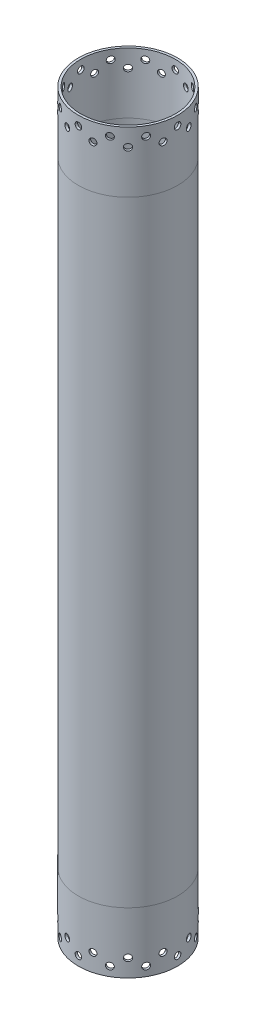
from build123d import *

# Parameters (mm, degrees)
SKETCH2_R                = 76.2
SKETCH2_R_2              = 72.5932
BOSS_EXTRUDE1_DEPTH      = 1130.3
SKETCH3_R                = 5.0419
CUT_EXTRUDE1_DEPTH       = 1143
SKETCH6_R                = 5.0419
CUT_EXTRUDE2_DEPTH       = 25.4
CIRPATTERN2_COUNT        = 12
MIRROR1_COPY_1_SKETCH_R  = 5.0419
MIRROR1_COPY_1_DEPTH     = 1143
MIRROR1_COPY_2_SKETCH_R  = 5.0419
MIRROR1_COPY_2_DEPTH     = 1143
MIRROR1_COPY_3_SKETCH_R  = 5.0419
MIRROR1_COPY_3_DEPTH     = 1143
MIRROR1_COPY_4_SKETCH_R  = 5.0419
MIRROR1_COPY_4_DEPTH     = 1143
MIRROR1_COPY_5_SKETCH_R  = 5.0419
MIRROR1_COPY_5_DEPTH     = 1143
MIRROR1_COPY_6_SKETCH_R  = 5.0419
MIRROR1_COPY_6_DEPTH     = 1143
MIRROR1_COPY_7_SKETCH_R  = 5.0419
MIRROR1_COPY_7_DEPTH     = 1143
MIRROR1_COPY_8_SKETCH_R  = 5.0419
MIRROR1_COPY_8_DEPTH     = 1143
MIRROR1_COPY_9_SKETCH_R  = 5.0419
MIRROR1_COPY_9_DEPTH     = 1143
MIRROR1_COPY_10_SKETCH_R = 5.0419
MIRROR1_COPY_10_DEPTH    = 1143
MIRROR1_COPY_11_SKETCH_R = 5.0419
MIRROR1_COPY_11_DEPTH    = 1143
MIRROR1_COPY_12_SKETCH_R = 5.0419
MIRROR1_COPY_12_DEPTH    = 25.4
MIRROR1_COPY_13_SKETCH_R = 5.0419
MIRROR1_COPY_13_DEPTH    = 25.4
MIRROR1_COPY_14_SKETCH_R = 5.0419
MIRROR1_COPY_14_DEPTH    = 25.4
MIRROR1_COPY_15_SKETCH_R = 5.0419
MIRROR1_COPY_15_DEPTH    = 25.4
MIRROR1_COPY_16_SKETCH_R = 5.0419
MIRROR1_COPY_16_DEPTH    = 25.4
MIRROR1_COPY_17_SKETCH_R = 5.0419
MIRROR1_COPY_17_DEPTH    = 25.4
MIRROR1_COPY_18_SKETCH_R = 5.0419
MIRROR1_COPY_18_DEPTH    = 25.4
MIRROR1_COPY_19_SKETCH_R = 5.0419
MIRROR1_COPY_19_DEPTH    = 25.4
MIRROR1_COPY_20_SKETCH_R = 5.0419
MIRROR1_COPY_20_DEPTH    = 25.4
MIRROR1_COPY_21_SKETCH_R = 5.0419
MIRROR1_COPY_21_DEPTH    = 25.4
MIRROR1_COPY_22_SKETCH_R = 5.0419
MIRROR1_COPY_22_DEPTH    = 25.4
MIRROR1_COPY_23_SKETCH_R = 5.0419
MIRROR1_COPY_23_DEPTH    = 1143
MIRROR1_COPY_24_SKETCH_R = 5.0419
MIRROR1_COPY_24_DEPTH    = 25.4


with BuildPart() as part:
    # Sketch2 → Boss-Extrude1 (new body)
    with BuildSketch(Plane(origin=(0, 0, 0), x_dir=(1, 0, 0), z_dir=(0, 1, 0))):
        Circle(SKETCH2_R)
        Circle(SKETCH2_R_2, mode=Mode.SUBTRACT)
    extrude(amount=BOSS_EXTRUDE1_DEPTH)

    # Sketch3 → Cut-Extrude1 (cut)
    with BuildSketch(Plane.XY):
        with Locations((0, 1116.203)):
            Circle(SKETCH3_R)
    cut_extrude1 = extrude(amount=-CUT_EXTRUDE1_DEPTH, mode=Mode.SUBTRACT)

    # Sketch6 → Cut-Extrude2 (cut)
    with BuildSketch(Plane(origin=(-19.722011237, 0, 73.603547963), x_dir=(0, -1, 0), z_dir=(-0.25881904510252135, 0, 0.9659258262890681))):
        with Locations((-1103.503, 0)):
            Circle(SKETCH6_R)
    cut_extrude2 = extrude(amount=-CUT_EXTRUDE2_DEPTH, mode=Mode.SUBTRACT)

    # CirPattern2: Cut-Extrude1, Cut-Extrude2 ×12 about axis
    cirpattern2_axis = Axis((0, 1130.3, 0), (0, -1, 0))
    add([cut_extrude1.rotate(cirpattern2_axis, i * 360 / CIRPATTERN2_COUNT) for i in range(1, CIRPATTERN2_COUNT)], mode=Mode.SUBTRACT)
    add([cut_extrude2.rotate(cirpattern2_axis, i * 360 / CIRPATTERN2_COUNT) for i in range(1, CIRPATTERN2_COUNT)], mode=Mode.SUBTRACT)

    # Mirror1 copy 1 sketch → Mirror1 copy 1 (cut)
    with BuildSketch(Plane(origin=(0, 1130.3, 0), x_dir=(0.8660254037844387, 0, 0.49999999999999994), z_dir=(-0.49999999999999994, 0, 0.8660254037844387))):
        with Locations((0, -1116.203)):
            Circle(MIRROR1_COPY_1_SKETCH_R)
    extrude(amount=-MIRROR1_COPY_1_DEPTH, mode=Mode.SUBTRACT)

    # Mirror1 copy 2 sketch → Mirror1 copy 2 (cut)
    with BuildSketch(Plane(origin=(0, 1130.3, 0), x_dir=(0.5000000000000001, 0, 0.8660254037844386), z_dir=(-0.8660254037844386, 0, 0.5000000000000001))):
        with Locations((0, -1116.203)):
            Circle(MIRROR1_COPY_2_SKETCH_R)
    extrude(amount=-MIRROR1_COPY_2_DEPTH, mode=Mode.SUBTRACT)

    # Mirror1 copy 3 sketch → Mirror1 copy 3 (cut)
    with BuildSketch(Plane(origin=(0, 1130.3, 0), x_dir=(0, 0, 1), z_dir=(-1, 0, 0))):
        with Locations((0, -1116.203)):
            Circle(MIRROR1_COPY_3_SKETCH_R)
    extrude(amount=-MIRROR1_COPY_3_DEPTH, mode=Mode.SUBTRACT)

    # Mirror1 copy 4 sketch → Mirror1 copy 4 (cut)
    with BuildSketch(Plane(origin=(0, 1130.3, 0), x_dir=(-0.4999999999999998, 0, 0.8660254037844387), z_dir=(-0.8660254037844387, 0, -0.4999999999999998))):
        with Locations((0, -1116.203)):
            Circle(MIRROR1_COPY_4_SKETCH_R)
    extrude(amount=-MIRROR1_COPY_4_DEPTH, mode=Mode.SUBTRACT)

    # Mirror1 copy 5 sketch → Mirror1 copy 5 (cut)
    with BuildSketch(Plane(origin=(0, 1130.3, 0), x_dir=(-0.8660254037844387, 0, 0.49999999999999994), z_dir=(-0.49999999999999994, 0, -0.8660254037844387))):
        with Locations((0, -1116.203)):
            Circle(MIRROR1_COPY_5_SKETCH_R)
    extrude(amount=-MIRROR1_COPY_5_DEPTH, mode=Mode.SUBTRACT)

    # Mirror1 copy 6 sketch → Mirror1 copy 6 (cut)
    with BuildSketch(Plane(origin=(0, 1130.3, 0), x_dir=(-1, 0, 0), z_dir=(0, 0, -1))):
        with Locations((0, -1116.203)):
            Circle(MIRROR1_COPY_6_SKETCH_R)
    extrude(amount=-MIRROR1_COPY_6_DEPTH, mode=Mode.SUBTRACT)

    # Mirror1 copy 7 sketch → Mirror1 copy 7 (cut)
    with BuildSketch(Plane(origin=(0, 1130.3, 0), x_dir=(-0.8660254037844386, 0, -0.5000000000000001), z_dir=(0.5000000000000001, 0, -0.8660254037844386))):
        with Locations((0, -1116.203)):
            Circle(MIRROR1_COPY_7_SKETCH_R)
    extrude(amount=-MIRROR1_COPY_7_DEPTH, mode=Mode.SUBTRACT)

    # Mirror1 copy 8 sketch → Mirror1 copy 8 (cut)
    with BuildSketch(Plane(origin=(0, 1130.3, 0), x_dir=(-0.5000000000000004, 0, -0.8660254037844384), z_dir=(0.8660254037844384, 0, -0.5000000000000004))):
        with Locations((0, -1116.203)):
            Circle(MIRROR1_COPY_8_SKETCH_R)
    extrude(amount=-MIRROR1_COPY_8_DEPTH, mode=Mode.SUBTRACT)

    # Mirror1 copy 9 sketch → Mirror1 copy 9 (cut)
    with BuildSketch(Plane(origin=(0, 1130.3, 0), x_dir=(0, 0, -1), z_dir=(1, 0, 0))):
        with Locations((0, -1116.203)):
            Circle(MIRROR1_COPY_9_SKETCH_R)
    extrude(amount=-MIRROR1_COPY_9_DEPTH, mode=Mode.SUBTRACT)

    # Mirror1 copy 10 sketch → Mirror1 copy 10 (cut)
    with BuildSketch(Plane(origin=(0, 1130.3, 0), x_dir=(0.5000000000000001, 0, -0.8660254037844386), z_dir=(0.8660254037844386, 0, 0.5000000000000001))):
        with Locations((0, -1116.203)):
            Circle(MIRROR1_COPY_10_SKETCH_R)
    extrude(amount=-MIRROR1_COPY_10_DEPTH, mode=Mode.SUBTRACT)

    # Mirror1 copy 11 sketch → Mirror1 copy 11 (cut)
    with BuildSketch(Plane(origin=(0, 1130.3, 0), x_dir=(0.8660254037844384, 0, -0.5000000000000004), z_dir=(0.5000000000000004, 0, 0.8660254037844384))):
        with Locations((0, -1116.203)):
            Circle(MIRROR1_COPY_11_SKETCH_R)
    extrude(amount=-MIRROR1_COPY_11_DEPTH, mode=Mode.SUBTRACT)

    # Mirror1 copy 12 sketch → Mirror1 copy 12 (cut)
    with BuildSketch(Plane(origin=(-53.881536726, 1130.3, 53.881536726), x_dir=(0, 1, 0), z_dir=(-0.7071067811865479, 0, 0.7071067811865472))):
        with Locations((-1103.503, 0)):
            Circle(MIRROR1_COPY_12_SKETCH_R)
    extrude(amount=-MIRROR1_COPY_12_DEPTH, mode=Mode.SUBTRACT)

    # Mirror1 copy 13 sketch → Mirror1 copy 13 (cut)
    with BuildSketch(Plane(origin=(-73.603547963, 1130.3, 19.722011237), x_dir=(0, 1, 0), z_dir=(-0.9659258262890684, 0, 0.2588190451025203))):
        with Locations((-1103.503, 0)):
            Circle(MIRROR1_COPY_13_SKETCH_R)
    extrude(amount=-MIRROR1_COPY_13_DEPTH, mode=Mode.SUBTRACT)

    # Mirror1 copy 14 sketch → Mirror1 copy 14 (cut)
    with BuildSketch(Plane(origin=(-73.603547963, 1130.3, -19.722011237), x_dir=(0, 1, 0), z_dir=(-0.9659258262890681, 0, -0.2588190451025213))):
        with Locations((-1103.503, 0)):
            Circle(MIRROR1_COPY_14_SKETCH_R)
    extrude(amount=-MIRROR1_COPY_14_DEPTH, mode=Mode.SUBTRACT)

    # Mirror1 copy 15 sketch → Mirror1 copy 15 (cut)
    with BuildSketch(Plane(origin=(-53.881536726, 1130.3, -53.881536726), x_dir=(0, 1, 0), z_dir=(-0.7071067811865472, 0, -0.7071067811865477))):
        with Locations((-1103.503, 0)):
            Circle(MIRROR1_COPY_15_SKETCH_R)
    extrude(amount=-MIRROR1_COPY_15_DEPTH, mode=Mode.SUBTRACT)

    # Mirror1 copy 16 sketch → Mirror1 copy 16 (cut)
    with BuildSketch(Plane(origin=(-19.722011237, 1130.3, -73.603547963), x_dir=(0, 1, 0), z_dir=(-0.2588190451025201, 0, -0.9659258262890684))):
        with Locations((-1103.503, 0)):
            Circle(MIRROR1_COPY_16_SKETCH_R)
    extrude(amount=-MIRROR1_COPY_16_DEPTH, mode=Mode.SUBTRACT)

    # Mirror1 copy 17 sketch → Mirror1 copy 17 (cut)
    with BuildSketch(Plane(origin=(19.722011237, 1130.3, -73.603547963), x_dir=(0, 1, 0), z_dir=(0.25881904510252124, 0, -0.9659258262890681))):
        with Locations((-1103.503, 0)):
            Circle(MIRROR1_COPY_17_SKETCH_R)
    extrude(amount=-MIRROR1_COPY_17_DEPTH, mode=Mode.SUBTRACT)

    # Mirror1 copy 18 sketch → Mirror1 copy 18 (cut)
    with BuildSketch(Plane(origin=(53.881536726, 1130.3, -53.881536726), x_dir=(0, 1, 0), z_dir=(0.707106781186548, 0, -0.707106781186547))):
        with Locations((-1103.503, 0)):
            Circle(MIRROR1_COPY_18_SKETCH_R)
    extrude(amount=-MIRROR1_COPY_18_DEPTH, mode=Mode.SUBTRACT)

    # Mirror1 copy 19 sketch → Mirror1 copy 19 (cut)
    with BuildSketch(Plane(origin=(73.603547963, 1130.3, -19.722011237), x_dir=(0, 1, 0), z_dir=(0.9659258262890683, 0, -0.25881904510252063))):
        with Locations((-1103.503, 0)):
            Circle(MIRROR1_COPY_19_SKETCH_R)
    extrude(amount=-MIRROR1_COPY_19_DEPTH, mode=Mode.SUBTRACT)

    # Mirror1 copy 20 sketch → Mirror1 copy 20 (cut)
    with BuildSketch(Plane(origin=(73.603547963, 1130.3, 19.722011237), x_dir=(0, 1, 0), z_dir=(0.9659258262890681, 0, 0.2588190451025212))):
        with Locations((-1103.503, 0)):
            Circle(MIRROR1_COPY_20_SKETCH_R)
    extrude(amount=-MIRROR1_COPY_20_DEPTH, mode=Mode.SUBTRACT)

    # Mirror1 copy 21 sketch → Mirror1 copy 21 (cut)
    with BuildSketch(Plane(origin=(53.881536726, 1130.3, 53.881536726), x_dir=(0, 1, 0), z_dir=(0.707106781186547, 0, 0.707106781186548))):
        with Locations((-1103.503, 0)):
            Circle(MIRROR1_COPY_21_SKETCH_R)
    extrude(amount=-MIRROR1_COPY_21_DEPTH, mode=Mode.SUBTRACT)

    # Mirror1 copy 22 sketch → Mirror1 copy 22 (cut)
    with BuildSketch(Plane(origin=(19.722011237, 1130.3, 73.603547963), x_dir=(0, 1, 0), z_dir=(0.25881904510252063, 0, 0.9659258262890683))):
        with Locations((-1103.503, 0)):
            Circle(MIRROR1_COPY_22_SKETCH_R)
    extrude(amount=-MIRROR1_COPY_22_DEPTH, mode=Mode.SUBTRACT)

    # Mirror1 copy 23 sketch → Mirror1 copy 23 (cut)
    with BuildSketch(Plane(origin=(0, 1130.3, 0), x_dir=(1, 0, 0), z_dir=(0, 0, 1))):
        with Locations((0, -1116.203)):
            Circle(MIRROR1_COPY_23_SKETCH_R)
    extrude(amount=-MIRROR1_COPY_23_DEPTH, mode=Mode.SUBTRACT)

    # Mirror1 copy 24 sketch → Mirror1 copy 24 (cut)
    with BuildSketch(Plane(origin=(-19.722011237, 1130.3, 73.603547963), x_dir=(0, 1, 0), z_dir=(-0.25881904510252135, 0, 0.9659258262890681))):
        with Locations((-1103.503, 0)):
            Circle(MIRROR1_COPY_24_SKETCH_R)
    extrude(amount=-MIRROR1_COPY_24_DEPTH, mode=Mode.SUBTRACT)


solid = part.part
